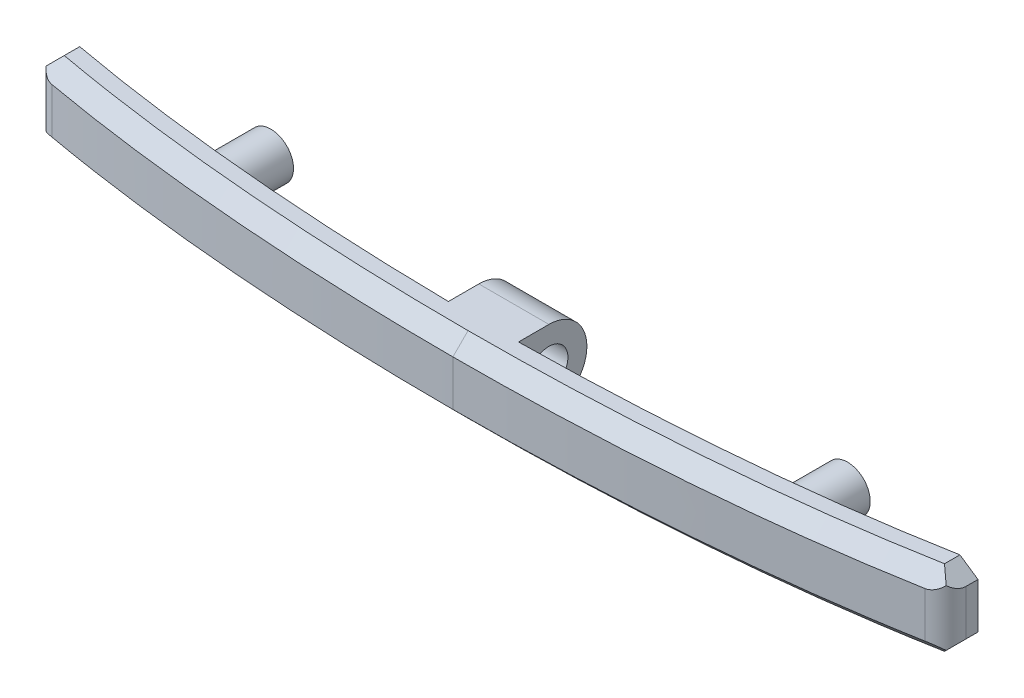
from build123d import *

# Parameters (mm, degrees)
SALIENTE_EXTRUIR2_DEPTH      = 5
CROQUIS6_R                   = 3
SALIENTE_EXTRUIR3_DEPTH      = 10
CROQUIS7_R                   = 1.75
CORTAR_EXTRUIR1_DEPTH        = 10
CHAFL_N1_SIZE                = 2
REDONDEO2_START              = -5.0000001
REDONDEO2_DEPTH              = 10.0000002
SALIENTE_EXTRUIR8_DEPTH      = 4.62
SALIENTE_EXTRUIR8_DEPTH_BACK = 4.62
CROQUIS17_R                  = 2.5


with BuildPart() as part:
    # Croquis5 → Saliente-Extruir2 (new, symmetric)
    with BuildSketch(Plane(origin=(0, 0, 0), x_dir=(1, 0, 0), z_dir=(0, 1, 0))):
        with BuildLine():
            Line((0, -26), (0, -30))
            add(Edge.make_bspline(
                [(0, -30), (3.306526268, -30), (16.53263134, -29.831217065), (35.997648536, -28.565345051), (52.057120801, -26.333176426), (58.766277483, -25.109762555), (60, -24.873829164)],
                knots=[4.71238898, 4.71238898, 4.71238898, 4.71238898, 4.810563751, 5.105088062, 5.301437603, 5.346535107, 5.346535107, 5.346535107, 5.346535107], degree=3))
            Line((60, -24.873829164), (60, -20.8))
            add(Edge.make_bspline(
                [(0, -26), (33.333333333, -26), (60, -20.8)],
                knots=[4.71238898, 4.71238898, 4.71238898, 5.355890089, 5.355890089, 5.355890089], degree=2, weights=[1, 0.948683298, 1]))
        make_face()
    extrude(amount=SALIENTE_EXTRUIR2_DEPTH, both=True)

    # Croquis6 → Saliente-Extruir3 (add)
    with BuildSketch(Plane.XY.offset(26)):
        with Locations((38, 0)):
            Circle(CROQUIS6_R)
    extrude(amount=-SALIENTE_EXTRUIR3_DEPTH)

    # Croquis7 → Cortar-Extruir1 (cut)
    with BuildSketch(Plane(origin=(0, 0, 16), x_dir=(-1, 0, 0), z_dir=(0, 0, -1))):
        with Locations((-38, 0)):
            Circle(CROQUIS7_R)
    extrude(amount=-CORTAR_EXTRUIR1_DEPTH, mode=Mode.SUBTRACT)

    # Chaflán1
    chafl_n1_edges = [part.edges().sort_by_distance(p)[0] for p in [
        (60, -5, 22.836914582),
        (60, 5, 22.836914582),
        (30.12007931, -5, 28.805559056),
        (30.12007931, 5, 28.805559056),
    ]]
    chamfer(chafl_n1_edges, length=CHAFL_N1_SIZE)

    # Redondeo2: read off the stored shape, not the designer's step
    # Redondeo2 outline → Redondeo2 (cut)
    with BuildSketch(Plane(origin=(0, 0, 0), x_dir=(1, 0, 0), z_dir=(0, 1, 0)).offset(REDONDEO2_START)):
        with BuildLine():
            Line((60, -24.873829164), (60, -22.378802425))
            ThreePointArc((60, -22.378802425), (59.301153244, -24.303560526), (57.530204169, -25.331577991))
            add(Edge.make_bspline(
                [(57.530204169, -25.331577991), (58.36173126, -25.182267919), (59.185100773, -25.029668046), (60, -24.873829164)],
                knots=[5.316747273, 5.316747273, 5.316747273, 5.316747273, 5.346535107, 5.346535107, 5.346535107, 5.346535107], degree=3))
        make_face()
    extrude(amount=REDONDEO2_DEPTH, mode=Mode.SUBTRACT)

    # Croquis17 → Saliente-Extruir8 (add, two sides: drawn at the far end of the back side and taken through both)
    with BuildSketch(Plane(origin=(0, 0, 0), x_dir=(0, 0, -1), z_dir=(1, 0, 0)).offset(-SALIENTE_EXTRUIR8_DEPTH_BACK)):
        with BuildLine():
            ThreePointArc((-21.96097599, 5), (-16.96097599, 0), (-21.96097599, -5))
            Line((-21.96097599, -5), (-26.96097599, -5))
            Line((-26.96097599, -5), (-26.96097599, 5))
            Line((-26.96097599, 5), (-21.96097599, 5))
        make_face()
        with Locations((-21.96097599, 0)):
            Circle(CROQUIS17_R, mode=Mode.SUBTRACT)
    extrude(amount=SALIENTE_EXTRUIR8_DEPTH + SALIENTE_EXTRUIR8_DEPTH_BACK)

    # Simetría2: part across plane


with BuildPart() as part_1:
    add(part.part)
    add(part.part.mirror(Plane(origin=(0, 0, 0), x_dir=(0, 0, 1), z_dir=(1, 0, 0))))


solid = part_1.part
